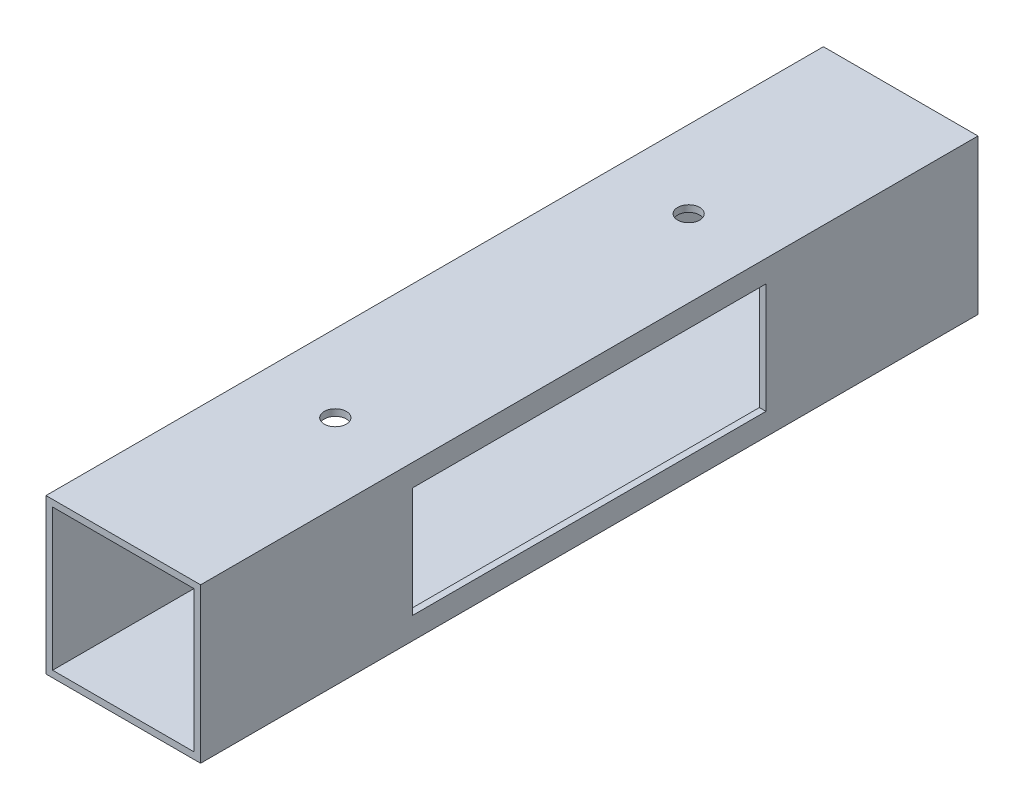
from build123d import *

# Parameters (mm, degrees)
MOTORBLOCKSKETCH_W         = 35
MOTORBLOCKSKETCH_H         = 35
MOTORBLOCKSKETCH_W_2       = 32
MOTORBLOCKSKETCH_H_2       = 32
BOSS_EXTRU_1_DEPTH         = 88
ESQUISSE3_W                = 80
ESQUISSE3_H                = 25
ENL_V_MAT_EXTRU_1_DEPTH    = 97.308099348
DRILLLEFTMOTORFIXSKETCH_R  = 2.5
ENL_V_MAT_EXTRU_2_DEPTH    = 5
DRILLRIGHTMOTORFIXSKETCH_R = 2.5
ENL_V_MAT_EXTRU_3_DEPTH    = 5


with BuildPart() as part:
    # MotorBlockSketch → Boss.-Extru.1 (new, symmetric)
    with BuildSketch(Plane.XY):
        Rectangle(MOTORBLOCKSKETCH_W, MOTORBLOCKSKETCH_H)
        Rectangle(MOTORBLOCKSKETCH_W_2, MOTORBLOCKSKETCH_H_2, mode=Mode.SUBTRACT)
    extrude(amount=BOSS_EXTRU_1_DEPTH, both=True)

    # Esquisse3 → Enlèv. mat.-Extru.1 (cut, through all)
    with BuildSketch(Plane(origin=(17.5, 0, 0), x_dir=(0, 0, -1), z_dir=(1, 0, 0))):
        Rectangle(ESQUISSE3_W, ESQUISSE3_H)
    extrude(amount=-ENL_V_MAT_EXTRU_1_DEPTH, mode=Mode.SUBTRACT)

    # DrillLeftMotorFixSketch → Enlèv. mat.-Extru.2 (cut)
    with BuildSketch(Plane(origin=(0, 17.5, 0), x_dir=(1, 0, 0), z_dir=(0, 1, 0))):
        with Locations((0, 40)):
            Circle(DRILLLEFTMOTORFIXSKETCH_R)
    extrude(amount=-ENL_V_MAT_EXTRU_2_DEPTH, mode=Mode.SUBTRACT)

    # DrillRightMotorFixSketch → Enlèv. mat.-Extru.3 (cut)
    with BuildSketch(Plane(origin=(0, 17.5, 0), x_dir=(1, 0, 0), z_dir=(0, 1, 0))):
        with Locations((0, -40)):
            Circle(DRILLRIGHTMOTORFIXSKETCH_R)
    extrude(amount=-ENL_V_MAT_EXTRU_3_DEPTH, mode=Mode.SUBTRACT)


solid = part.part
